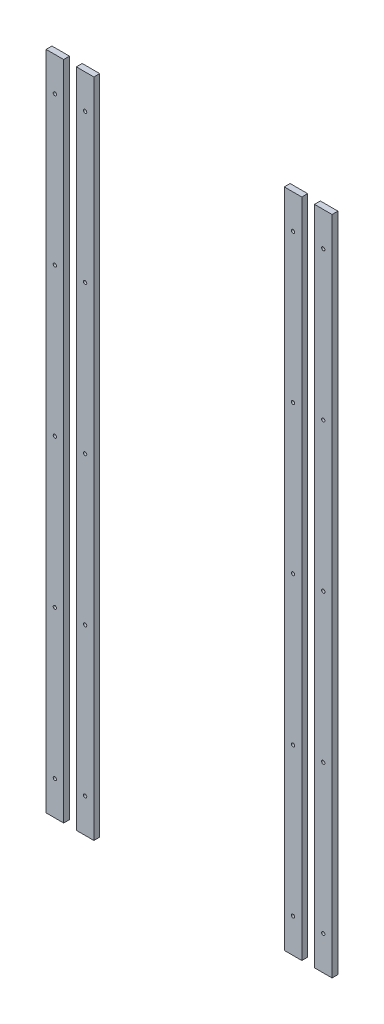
from build123d import *

# Parameters (mm, degrees)
SKETCH_1961_W          = 18
SKETCH_1961_H          = 678
EXTRUDE_6_DEPTH        = 6
EXTRUDE_6_2_DEPTH      = 6
EXTRUDE_6_3_DEPTH      = 6
EXTRUDE_6_4_DEPTH      = 6
SKETCH_3_R             = 1.7
CUT_EXTRUDE_3_DEPTH    = 757.340326837
PATTERN_LINEAR_5_COUNT = 5
PATTERN_LINEAR_5_PITCH = 152


with BuildPart() as part:
    # Sketch 1961 → Четыре_направляющие_6мм (new body)
    with BuildSketch(Plane.XY):
        with Locations((334.5, -96)):
            Rectangle(SKETCH_1961_W, SKETCH_1961_H)
    extrude(amount=EXTRUDE_6_DEPTH)


with BuildPart() as body_2:
    # Sketch 1961 → Extrude 6 2 (new body)
    with BuildSketch(Plane.XY):
        with Locations((365.5, -96)):
            Rectangle(SKETCH_1961_W, SKETCH_1961_H)
    extrude(amount=EXTRUDE_6_2_DEPTH)


with BuildPart() as body_3:
    # Sketch 1961 → Extrude 6 3 (new body)
    with BuildSketch(Plane.XY):
        with Locations((578.7, -96)):
            Rectangle(SKETCH_1961_W, SKETCH_1961_H)
    extrude(amount=EXTRUDE_6_3_DEPTH)


with BuildPart() as body_4:
    # Sketch 1961 → Extrude 6 4 (new body)
    with BuildSketch(Plane.XY):
        with Locations((609.7, -96)):
            Rectangle(SKETCH_1961_W, SKETCH_1961_H)
    extrude(amount=EXTRUDE_6_4_DEPTH)


with BuildPart() as cut_extrude_3_tool:
    # Крепление_направляющих_М3_эскиз → Проходы_направляющих_М3 (new, symmetric)
    with BuildSketch(Plane.XY):
        with Locations((334.5, -400)):
            Circle(SKETCH_3_R)
        with Locations((365.5, -400)):
            Circle(SKETCH_3_R)
        with Locations((578.7, -400)):
            Circle(SKETCH_3_R)
        with Locations((609.7, -400)):
            Circle(SKETCH_3_R)
    cut_extrude_3 = extrude(amount=CUT_EXTRUDE_3_DEPTH, both=True)


with BuildPart() as part_1:
    add(part.part)

    # Проходы_направляющих_М3: cut by cut_extrude_3_tool
    add(cut_extrude_3_tool.part, mode=Mode.SUBTRACT)


with BuildPart() as body_2_1:
    add(body_2.part)

    # Проходы_направляющих_М3: cut by cut_extrude_3_tool
    add(cut_extrude_3_tool.part, mode=Mode.SUBTRACT)


with BuildPart() as body_3_1:
    add(body_3.part)

    # Проходы_направляющих_М3: cut by cut_extrude_3_tool
    add(cut_extrude_3_tool.part, mode=Mode.SUBTRACT)


with BuildPart() as body_4_1:
    add(body_4.part)

    # Проходы_направляющих_М3: cut by cut_extrude_3_tool
    add(cut_extrude_3_tool.part, mode=Mode.SUBTRACT)


with BuildPart() as pattern_linear_5_tool:
    # Массив_крепления_направляющих_5рядов: Проходы_направляющих_М3 ×5
    with Locations(*[(0, i * PATTERN_LINEAR_5_PITCH, 0) for i in range(1, PATTERN_LINEAR_5_COUNT)]):
        add(cut_extrude_3)


with BuildPart() as part_2:
    add(part_1.part)

    # Массив_крепления_направляющих_5рядов: cut by pattern_linear_5_tool
    add(pattern_linear_5_tool.part, mode=Mode.SUBTRACT)


with BuildPart() as body_2_2:
    add(body_2_1.part)

    # Массив_крепления_направляющих_5рядов: cut by pattern_linear_5_tool
    add(pattern_linear_5_tool.part, mode=Mode.SUBTRACT)


with BuildPart() as body_3_2:
    add(body_3_1.part)

    # Массив_крепления_направляющих_5рядов: cut by pattern_linear_5_tool
    add(pattern_linear_5_tool.part, mode=Mode.SUBTRACT)


with BuildPart() as body_4_2:
    add(body_4_1.part)

    # Массив_крепления_направляющих_5рядов: cut by pattern_linear_5_tool
    add(pattern_linear_5_tool.part, mode=Mode.SUBTRACT)


solid = Compound([part_2.part, body_2_2.part, body_3_2.part, body_4_2.part])
